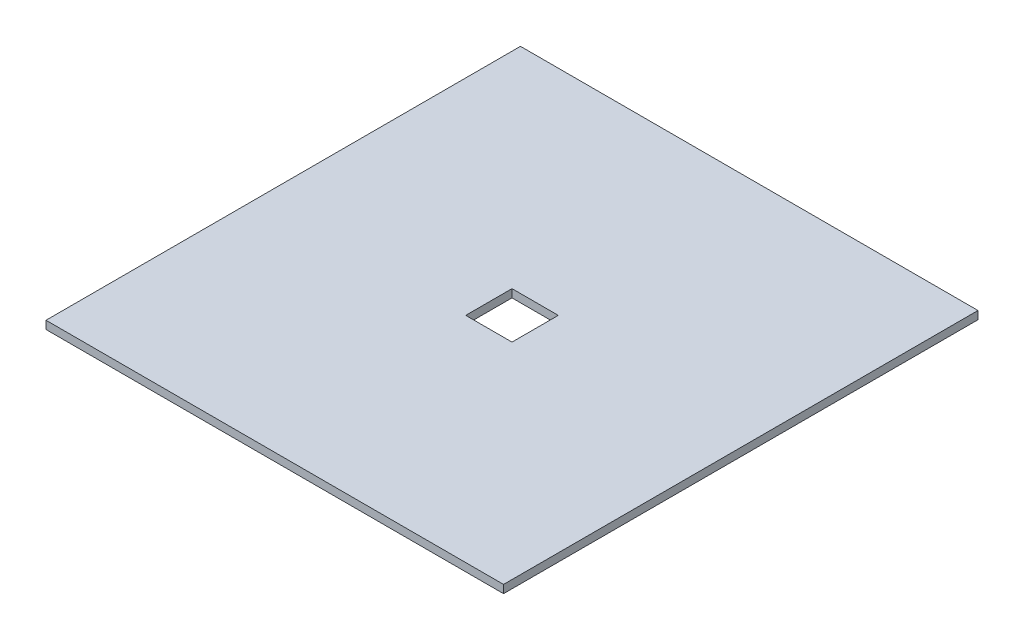
from build123d import *

# Parameters (mm, degrees)
SKETCH1_W           = 180.7718
SKETCH1_H           = 187.452
BOSS_EXTRUDE1_DEPTH = 3.175
SKETCH2_W           = 18.288
SKETCH2_H           = 18.288
CUT_EXTRUDE1_DEPTH  = 3.175


with BuildPart() as part:
    # Sketch1 → Boss-Extrude1 (new body)
    with BuildSketch(Plane(origin=(0, 0, 0), x_dir=(1, 0, 0), z_dir=(0, 1, 0))):
        Rectangle(SKETCH1_W, SKETCH1_H)
    extrude(amount=BOSS_EXTRUDE1_DEPTH)

    # Sketch2 → Cut-Extrude1 (cut)
    with BuildSketch(Plane(origin=(0, 3.175, 0), x_dir=(1, 0, 0), z_dir=(0, 1, 0))):
        Rectangle(SKETCH2_W, SKETCH2_H)
    extrude(amount=-CUT_EXTRUDE1_DEPTH, mode=Mode.SUBTRACT)


solid = part.part
